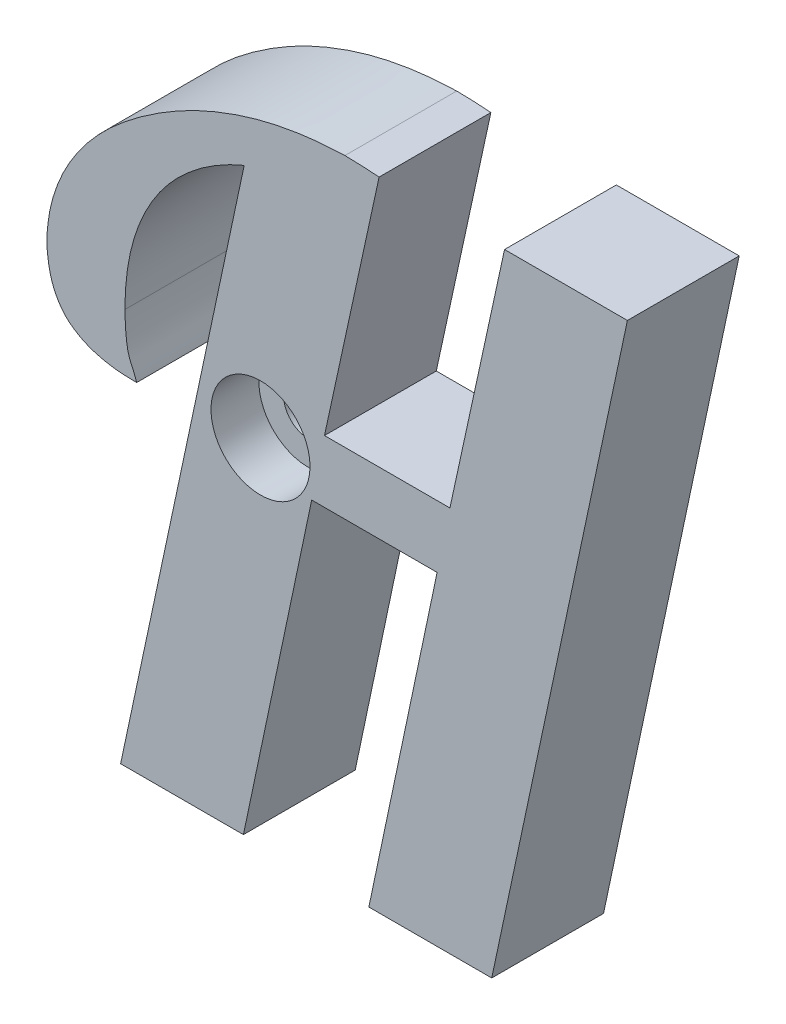
from build123d import *

# Parameters (mm, degrees)
EXTRUDE1_DEPTH = 7
SKETCH2_R      = 3.1
EXTRUDE2_DEPTH = 3
SKETCH3_R      = 1.55
EXTRUDE3_DEPTH = 13


with BuildPart() as part:
    # Sketch1 → Extrude1 (new body)
    with BuildSketch(Plane.XY):
        with BuildLine():
            add(Edge.make_bspline(
                [(27.858653535, 36.829997436), (27.508878082, 36.854867869), (26.796521858, 36.905519245), (26.082499446, 36.919554851), (25.719070605, 36.926698807)],
                knots=[0, 0, 0, 0, 0.982023994, 2, 2, 2, 2], degree=3))
            add(Edge.make_bspline(
                [(25.719070605, 36.926698807), (25.141265741, 36.898935859), (23.994731835, 36.843846047), (22.297037628, 36.615383104), (20.640162783, 36.269640865), (19.028714234, 35.795380491), (17.461390998, 35.204579868), (15.934226504, 34.502293617), (14.452991498, 33.6691717), (13.035088804, 32.731117775), (11.714676655, 31.716546907), (10.540484324, 30.642611333), (9.534029735, 29.518734751), (8.702055168, 28.34496809), (8.027752052, 27.130812287), (7.521537368, 25.870155773), (7.177340342, 24.5606479), (7.094198557, 23.664880348), (7.052407461, 23.214624099)],
                knots=[0, 0, 0, 0, 1.10196857, 2.186628061, 3.260330495, 4.32460639, 5.384285451, 6.449749881, 7.524675281, 8.619543896, 9.687076609, 10.694771607, 11.647676071, 12.556343369, 13.430971282, 14.28801645, 15.139473975, 16, 16, 16, 16], degree=3))
            add(Edge.make_bspline(
                [(7.052407461, 23.214624099), (7.056592755, 22.987730296), (7.064651879, 22.550827846), (7.133280398, 21.921977887), (7.2520562, 21.346599588), (7.399434942, 20.816449301), (7.611379263, 20.34371552), (7.86135723, 19.921995675), (8.145957143, 19.541720324), (8.612800227, 19.117243463), (9.309324053, 18.678950268), (10.29641342, 18.331094267), (11.436408393, 18.121340843), (12.248170455, 18.105913433), (12.679459539, 18.097716852)],
                knots=[0, 0, 0, 0, 0.929125253, 1.789106157, 2.585842986, 3.333778556, 4.037692191, 4.700042103, 5.339555779, 5.974175592, 7.273928474, 8.67942061, 10.235776574, 12, 12, 12, 12], degree=3))
            add(Edge.make_bspline(
                [(12.679459539, 18.097716852), (12.662285136, 18.154706902), (12.622731648, 18.285957769), (12.532649792, 18.499703698), (12.428562353, 18.769095072), (12.26361886, 19.087351608), (12.121386869, 19.523966533), (12.032712147, 20.104623573), (11.964453655, 20.840217782), (11.947006956, 21.385107073), (11.937430694, 21.684189606)],
                knots=[0, 0, 0, 0, 0.385812456, 0.888544919, 1.503015347, 2.25817801, 3.209407149, 4.464987798, 6.059678505, 8, 8, 8, 8], degree=3))
            add(Edge.make_bspline(
                [(11.937430694, 21.684189606), (11.946530774, 22.027046526), (11.964489097, 22.703648835), (12.056124124, 23.698099361), (12.210561965, 24.653798024), (12.426779498, 25.568537281), (12.704977513, 26.444876438), (13.045202219, 27.278924533), (13.442707974, 28.075066292), (13.896925418, 28.830199438), (14.408550046, 29.543785431), (14.974550536, 30.210863863), (15.594231003, 30.829287919), (16.263557493, 31.401586435), (16.971450373, 31.938295075), (17.738088859, 32.416712533), (18.548212269, 32.862440665), (19.121126729, 33.11274018), (19.411825419, 33.239742981)],
                knots=[0, 0, 0, 0, 1.121786689, 2.213761537, 3.264086548, 4.286269828, 5.285859661, 6.268787005, 7.229972349, 8.194109518, 9.148433801, 10.099215597, 11.052795187, 12.009052959, 12.978334189, 13.955753268, 14.962742458, 16, 16, 16, 16], degree=3))
            Line((19.411825419, 33.239742981), (11.674930743, -3.073301193))
            Line((11.674930743, -3.073301193), (19.363772891, -3.073301193))
            Line((19.363772891, -3.073301193), (23.637926674, 17.208820583))
            Line((23.637926674, 17.208820583), (31.49168425, 17.208820583))
            Line((31.49168425, 17.208820583), (27.217530467, -3.073301193))
            Line((27.217530467, -3.073301193), (34.911007276, -3.073301193))
            Line((34.911007276, -3.073301193), (43.40588792, 36.829997436))
            Line((43.40588792, 36.829997436), (35.712411111, 36.829997436))
            Line((35.712411111, 36.829997436), (32.293088084, 21.104472022))
            Line((32.293088084, 21.104472022), (24.439330508, 21.104472022))
            Line((24.439330508, 21.104472022), (27.858653535, 36.829997436))
        make_face()
    extrude(amount=EXTRUDE1_DEPTH)

    # Sketch2 → Extrude2 (cut)
    with BuildSketch(Plane.XY.offset(7)):
        with Locations((20.432982097, 18.973726098)):
            Circle(SKETCH2_R)
    extrude(amount=-EXTRUDE2_DEPTH, mode=Mode.SUBTRACT)

    # Sketch3 → Extrude3 (cut)
    with BuildSketch(Plane.XY.offset(4)):
        with Locations((20.432982097, 18.973726098)):
            Circle(SKETCH3_R)
    extrude(amount=-EXTRUDE3_DEPTH, mode=Mode.SUBTRACT)


solid = part.part
